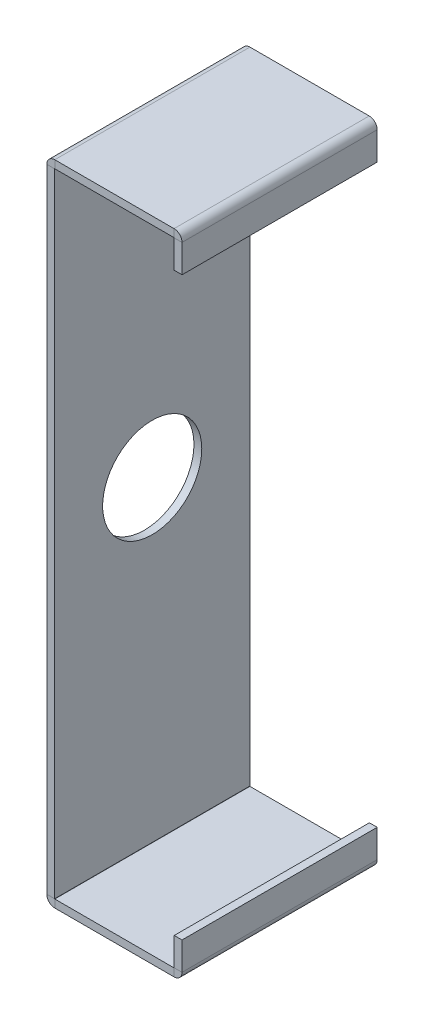
from build123d import *

# Parameters (mm, degrees)
SKETCH1_W                 = 15.494
SKETCH1_H                 = 3.175
BASE_FLANGE1_DEPTH        = 0.127
SKETCHED_START            = -1.5875
SKETCHED_BEND16_DEPTH     = 3.175
SKETCHED_BEND16_2_DEPTH   = 3.175
F_0_CLEARANCE_HOLE1_D     = 1.6129
F_0_CLEARANCE_HOLE1_DEPTH = 4.826
F_0_CLEARANCE_HOLE1_TIP   = 0.484564046


# Read off the part's stored shape, not the designer's step: Sketched Bend16
# Sheet-metal steps are written as plain solids
with BuildPart() as part:
    # Sketch1 → Base-Flange1 (new body)
    with BuildSketch(Plane(origin=(0, 0, 0), x_dir=(1, 0, 0), z_dir=(0, 1, 0))):
        Rectangle(SKETCH1_W, SKETCH1_H)
    extrude(amount=-BASE_FLANGE1_DEPTH)

    # Sketched Bend16 outline → Sketched Bend16 (cut)
    with BuildSketch(Plane.XY.offset(SKETCHED_START)):
        with BuildLine():
            ThreePointArc((5.246167695, -0.127), (5.155471554, -0.089952279), (5.116652599, 0))
            Line((5.116652599, 0), (-7.747, 0))
            Line((-7.747, 0), (-7.747, -0.127))
            Line((-7.747, -0.127), (5.246167695, -0.127))
        make_face()
        with BuildLine():
            Line((7.747, 0), (7.316647401, 0))
            ThreePointArc((7.316647401, 0), (7.277828446, -0.089952279), (7.187132305, -0.127))
            Line((7.187132305, -0.127), (7.747, -0.127))
            Line((7.747, -0.127), (7.747, 0))
        make_face()
    extrude(amount=SKETCHED_BEND16_DEPTH, mode=Mode.SUBTRACT)

    # Sketched Bend16 2 outline → Sketched Bend16 2 (add)
    with BuildSketch(Plane.XY.offset(SKETCHED_START)):
        with BuildLine():
            Line((5.243627695, 0.00254), (5.243627695, 10.287404611))
            ThreePointArc((5.243627695, 10.287404611), (5.244371643, 10.289200662), (5.246167695, 10.289944611))
            Line((5.246167695, 10.289944611), (7.187132305, 10.289944611))
            ThreePointArc((7.187132305, 10.289944611), (7.188928357, 10.289200662), (7.189672305, 10.287404611))
            Line((7.189672305, 10.287404611), (7.189672305, 9.831272305))
            Line((7.189672305, 9.831272305), (7.316672305, 9.831272305))
            Line((7.316672305, 9.831272305), (7.316672305, 10.287404611))
            ThreePointArc((7.316672305, 10.287404611), (7.278730917, 10.379003223), (7.187132305, 10.416944611))
            Line((7.187132305, 10.416944611), (5.246167695, 10.416944611))
            ThreePointArc((5.246167695, 10.416944611), (5.154569083, 10.379003223), (5.116627695, 10.287404611))
            Line((5.116627695, 10.287404611), (5.116627695, 0.00254))
            ThreePointArc((5.116627695, 0.00254), (5.116633921, 0.001269939), (5.116652599, 0))
            Line((5.116652599, 0), (5.246167695, 0))
            ThreePointArc((5.246167695, 0), (5.244371644, 0.000743949), (5.243627695, 0.00254))
        make_face()
        with BuildLine():
            ThreePointArc((7.189672305, 0.00254), (7.188928356, 0.000743949), (7.187132305, 0))
            Line((7.187132305, 0), (7.316647401, 0))
            ThreePointArc((7.316647401, 0), (7.316666079, 0.001269939), (7.316672305, 0.00254))
            Line((7.316672305, 0.00254), (7.316672305, 0.458672305))
            Line((7.316672305, 0.458672305), (7.189672305, 0.458672305))
            Line((7.189672305, 0.458672305), (7.189672305, 0.00254))
        make_face()
    extrude(amount=SKETCHED_BEND16_2_DEPTH)

    # #0 Clearance Hole1
    with Locations(Plane(origin=(5.243627695, 0, 0), x_dir=(0, 0, -1), z_dir=(1, 0, 0))):
        with Locations((0, 5.144972305)):
            Hole(F_0_CLEARANCE_HOLE1_D / 2, depth=F_0_CLEARANCE_HOLE1_DEPTH)
            with Locations((0, 0, -(F_0_CLEARANCE_HOLE1_DEPTH + F_0_CLEARANCE_HOLE1_TIP / 2))):  # 118° drill point
                Cone(0, F_0_CLEARANCE_HOLE1_D / 2, F_0_CLEARANCE_HOLE1_TIP, mode=Mode.SUBTRACT)


solid = part.part
